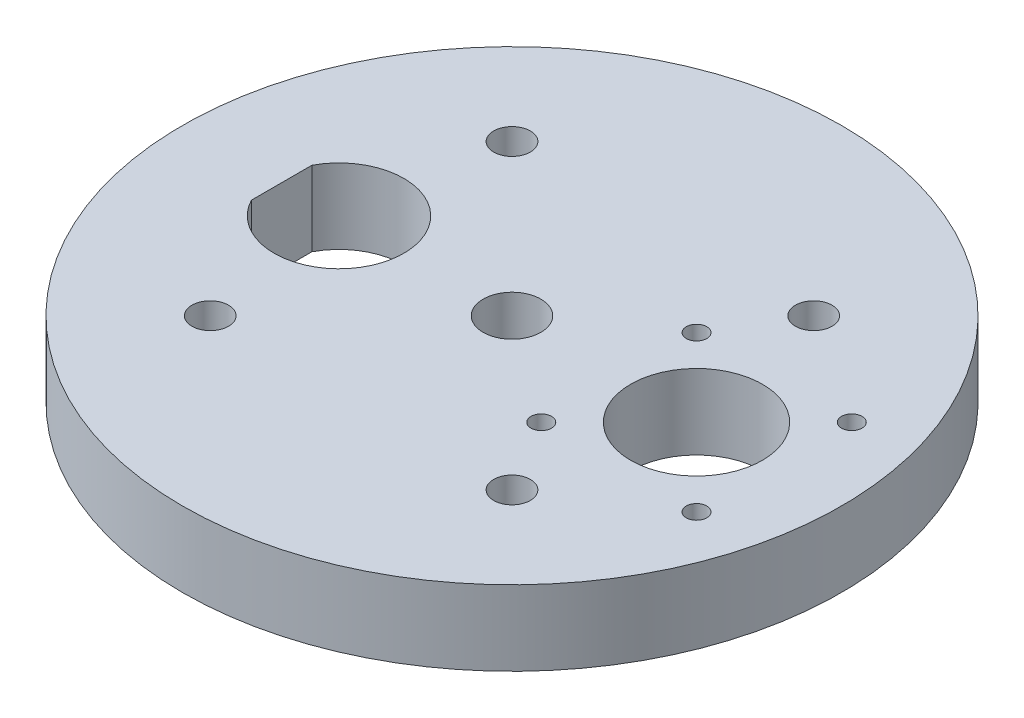
from build123d import *

# Parameters (mm, degrees)
SKETCH2_R           = 57.15
BOSS_EXTRUDE1_DEPTH = 13
CUT_EXTRUDE1_REACH  = 83.861
SKETCH6_R           = 3.175
SKETCH7_R           = 11.43
SKETCH7_R_2         = 1.778
CUT_EXTRUDE2_DEPTH  = 82.861132413
SKETCH8_R           = 5
CUT_EXTRUDE3_DEPTH  = 82.861132413


with BuildPart() as part:
    # Sketch2 → Boss-Extrude1 (new body)
    with BuildSketch(Plane(origin=(0, 0, 0), x_dir=(1, 0, 0), z_dir=(0, 1, 0))):
        Circle(SKETCH2_R)
    extrude(amount=BOSS_EXTRUDE1_DEPTH)

    # Sketch6 → Cut-Extrude1 (cut, up to next)
    with BuildSketch(Plane(origin=(0, 13, 0), x_dir=(1, 0, 0), z_dir=(0, 1, 0)), mode=Mode.PRIVATE) as cut_extrude1_sk1:
        with Locations((-26.1629, -26.1629)):
            Circle(SKETCH6_R)
    cut_extrude1_tool1 = extrude(cut_extrude1_sk1.sketch, amount=-CUT_EXTRUDE1_REACH, mode=Mode.PRIVATE) & part.part
    # Sketch6 → Cut-Extrude1 (cut, up to next)
    with BuildSketch(Plane(origin=(0, 13, 0), x_dir=(1, 0, 0), z_dir=(0, 1, 0)), mode=Mode.PRIVATE) as cut_extrude1_sk2:
        with Locations((26.1629, -26.1629)):
            Circle(SKETCH6_R)
    cut_extrude1_tool2 = extrude(cut_extrude1_sk2.sketch, amount=-CUT_EXTRUDE1_REACH, mode=Mode.PRIVATE) & part.part
    # Sketch6 → Cut-Extrude1 (cut, up to next)
    with BuildSketch(Plane(origin=(0, 13, 0), x_dir=(1, 0, 0), z_dir=(0, 1, 0)), mode=Mode.PRIVATE) as cut_extrude1_sk3:
        with Locations((-26.1629, 26.163103615)):
            Circle(SKETCH6_R)
    cut_extrude1_tool3 = extrude(cut_extrude1_sk3.sketch, amount=-CUT_EXTRUDE1_REACH, mode=Mode.PRIVATE) & part.part
    # Sketch6 → Cut-Extrude1 (cut, up to next)
    with BuildSketch(Plane(origin=(0, 13, 0), x_dir=(1, 0, 0), z_dir=(0, 1, 0)), mode=Mode.PRIVATE) as cut_extrude1_sk4:
        with Locations((26.1629, 26.163103615)):
            Circle(SKETCH6_R)
    cut_extrude1_tool4 = extrude(cut_extrude1_sk4.sketch, amount=-CUT_EXTRUDE1_REACH, mode=Mode.PRIVATE) & part.part
    add(cut_extrude1_tool1.solids().sort_by_distance((-26.1629, 13, 26.1629))[0], mode=Mode.SUBTRACT)
    add(cut_extrude1_tool2.solids().sort_by_distance((26.1629, 13, 26.1629))[0], mode=Mode.SUBTRACT)
    add(cut_extrude1_tool3.solids().sort_by_distance((-26.1629, 13, -26.163104))[0], mode=Mode.SUBTRACT)
    add(cut_extrude1_tool4.solids().sort_by_distance((26.1629, 13, -26.163104))[0], mode=Mode.SUBTRACT)

    # Sketch7 → Cut-Extrude2 (cut, through all)
    with BuildSketch(Plane(origin=(0, 13, 0), x_dir=(1, 0, 0), z_dir=(0, 1, 0))):
        with Locations((32, 0)):
            Circle(SKETCH7_R)
        with Locations((18.54, -13.464)):
            Circle(SKETCH7_R_2)
        with Locations((18.54, 13.46)):
            Circle(SKETCH7_R_2)
        with Locations((45.46, 13.46)):
            Circle(SKETCH7_R_2)
        with Locations((45.46, -13.464)):
            Circle(SKETCH7_R_2)
    extrude(amount=-CUT_EXTRUDE2_DEPTH, mode=Mode.SUBTRACT)

    # Sketch8 → Cut-Extrude3 (cut, through all)
    with BuildSketch(Plane(origin=(0, 13, 0), x_dir=(1, 0, 0), z_dir=(0, 1, 0))):
        Circle(SKETCH8_R)
        with BuildLine():
            Line((-39.95, 5.249761899), (-39.95, -5.249761899))
            ThreePointArc((-39.95, -5.249761899), (-18.75, 0), (-39.95, 5.249761899))
        make_face()
    extrude(amount=-CUT_EXTRUDE3_DEPTH, mode=Mode.SUBTRACT)


solid = part.part
